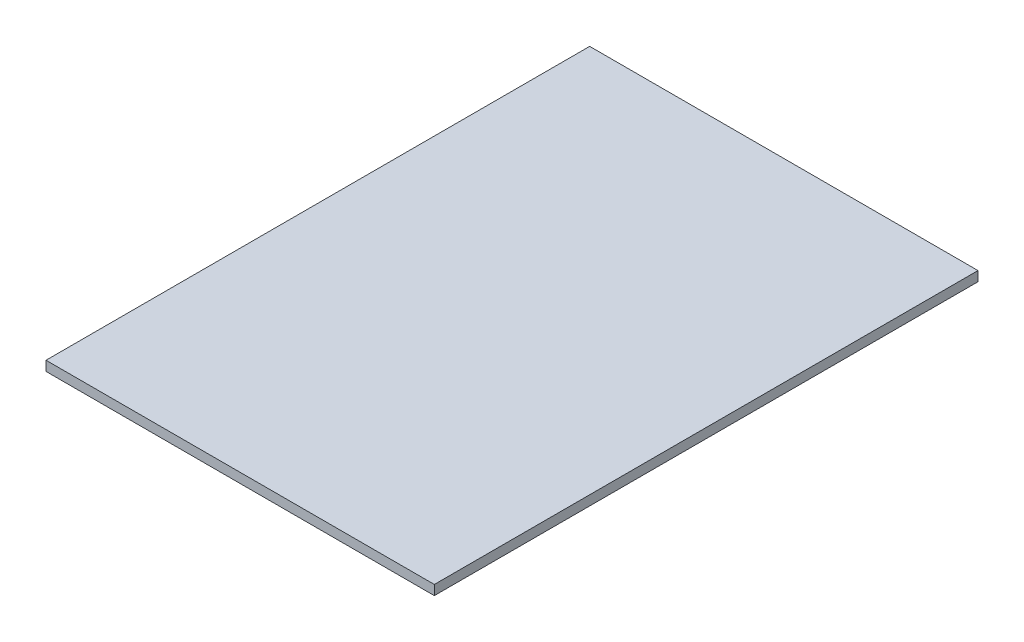
from build123d import *

# Parameters (mm, degrees)
SKETCH1_W           = 127
SKETCH1_H           = 177.8
BOSS_EXTRUDE2_DEPTH = 3.175


with BuildPart() as part:
    # Sketch1 → Boss-Extrude2 (new body)
    with BuildSketch(Plane(origin=(0, 0, 0), x_dir=(1, 0, 0), z_dir=(0, 1, 0))):
        with Locations((63.5, 88.9)):
            Rectangle(SKETCH1_W, SKETCH1_H)
    extrude(amount=BOSS_EXTRUDE2_DEPTH)


solid = part.part
